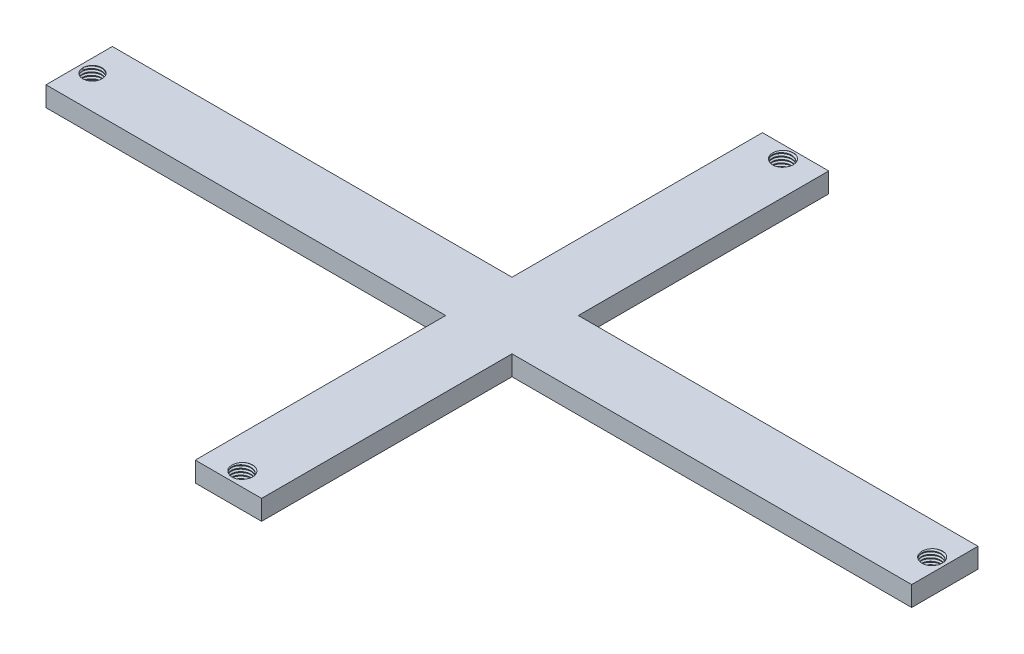
from build123d import *

# Parameters (mm, degrees)
SKETCH1_W                  = 130.5
SKETCH1_H                  = 10
SKETCH1_W_2                = 10
SKETCH1_H_2                = 85.5
BOSS_EXTRUDE1_DEPTH        = 3
M2_5_CLEARANCE_HOLE1_D     = 2.9
M2_5_CLEARANCE_HOLE1_DEPTH = 3
M2_5_CLEARANCE_HOLE1_TIP   = 0.871247898
M2_5_CLEARANCE_HOLE2_D     = 2.9
M2_5_CLEARANCE_HOLE2_DEPTH = 3
M2_5_CLEARANCE_HOLE2_TIP   = 0.871247898
M2_5_CLEARANCE_HOLE3_D     = 2.9
M2_5_CLEARANCE_HOLE3_DEPTH = 3
M2_5_CLEARANCE_HOLE3_TIP   = 0.871247898
M2_5_CLEARANCE_HOLE4_D     = 2.9
M2_5_CLEARANCE_HOLE4_DEPTH = 3
M2_5_CLEARANCE_HOLE4_TIP   = 0.871247898
THREAD4_PITCH              = 0.45
THREAD5_PITCH              = 0.45
THREAD6_PITCH              = 0.45
THREAD7_PITCH              = 0.45


with BuildPart() as part:
    # Sketch1 → Boss-Extrude1 (new body)
    with BuildSketch(Plane(origin=(0, 0, 0), x_dir=(1, 0, 0), z_dir=(0, 1, 0))):
        with Locations((40.207417437, 2.647058824)):
            Rectangle(SKETCH1_W, SKETCH1_H)
        with Locations((40.207417437, 2.647058824)):
            Rectangle(SKETCH1_W_2, SKETCH1_H_2)
    extrude(amount=BOSS_EXTRUDE1_DEPTH)

    # M2.5 Clearance Hole1
    with Locations(Plane(origin=(0, 3, 0), x_dir=(1, 0, 0), z_dir=(0, 1, 0))):
        with Locations((-23.042582563, 2.647058824)):
            Hole(M2_5_CLEARANCE_HOLE1_D / 2, depth=M2_5_CLEARANCE_HOLE1_DEPTH)
            with Locations((0, 0, -(M2_5_CLEARANCE_HOLE1_DEPTH + M2_5_CLEARANCE_HOLE1_TIP / 2))):  # 118° drill point
                Cone(0, M2_5_CLEARANCE_HOLE1_D / 2, M2_5_CLEARANCE_HOLE1_TIP, mode=Mode.SUBTRACT)

    # M2.5 Clearance Hole2
    with Locations(Plane(origin=(0, 3, 0), x_dir=(1, 0, 0), z_dir=(0, 1, 0))):
        with Locations((40.207417437, 43.397058824)):
            Hole(M2_5_CLEARANCE_HOLE2_D / 2, depth=M2_5_CLEARANCE_HOLE2_DEPTH)
            with Locations((0, 0, -(M2_5_CLEARANCE_HOLE2_DEPTH + M2_5_CLEARANCE_HOLE2_TIP / 2))):  # 118° drill point
                Cone(0, M2_5_CLEARANCE_HOLE2_D / 2, M2_5_CLEARANCE_HOLE2_TIP, mode=Mode.SUBTRACT)

    # M2.5 Clearance Hole3
    with Locations(Plane(origin=(0, 3, 0), x_dir=(1, 0, 0), z_dir=(0, 1, 0))):
        with Locations((103.457417437, 2.647058824)):
            Hole(M2_5_CLEARANCE_HOLE3_D / 2, depth=M2_5_CLEARANCE_HOLE3_DEPTH)
            with Locations((0, 0, -(M2_5_CLEARANCE_HOLE3_DEPTH + M2_5_CLEARANCE_HOLE3_TIP / 2))):  # 118° drill point
                Cone(0, M2_5_CLEARANCE_HOLE3_D / 2, M2_5_CLEARANCE_HOLE3_TIP, mode=Mode.SUBTRACT)

    # M2.5 Clearance Hole4
    with Locations(Plane(origin=(0, 3, 0), x_dir=(1, 0, 0), z_dir=(0, 1, 0))):
        with Locations((40.207417437, -38.102941176)):
            Hole(M2_5_CLEARANCE_HOLE4_D / 2, depth=M2_5_CLEARANCE_HOLE4_DEPTH)
            with Locations((0, 0, -(M2_5_CLEARANCE_HOLE4_DEPTH + M2_5_CLEARANCE_HOLE4_TIP / 2))):  # 118° drill point
                Cone(0, M2_5_CLEARANCE_HOLE4_D / 2, M2_5_CLEARANCE_HOLE4_TIP, mode=Mode.SUBTRACT)

    # Thread4: the profile of Thread Profile4 profile screwed along a right-hand helix of 7.649606 turns, 6 arcs to a turn; built about Z, then put on its axis
    thread4_z = Axis((0, 0, 0), (0, 0, 1))
    thread4_corners = [(1.4497, 0, -0.000173205), (1.693569644, 0, 0.140624999), (1.693569644, 0, 0.196874999), (1.4497, 0, 0.337673204)]
    with BuildLine(mode=Mode.PRIVATE) as thread4_profile:
        Line(thread4_corners[0], thread4_corners[1])
        Line(thread4_corners[1], thread4_corners[2])
        Line(thread4_corners[2], thread4_corners[3])
        Line(thread4_corners[3], thread4_corners[0])
    thread4_cap = Face(thread4_profile.wire())
    thread4_turn_angles = [0, 30, 60, 90, 120, 150, 180, 210, 240, 270, 300, 330, 360]
    thread4_turn_weights = [1, 0.8660254037844387, 1, 0.8660254037844387, 1, 0.8660254037844387, 1, 0.8660254037844387, 1, 0.8660254037844387, 1, 0.8660254037844387, 1]
    thread4_turn_rails = [Edge.make_bspline([Vector(p[0], p[1], 0).rotate(thread4_z, thread4_turn_angles[k]) / thread4_turn_weights[k] + Vector(0, 0, p[2] + THREAD4_PITCH * thread4_turn_angles[k] / 360) for k in range(13)], [0, 0, 0, 1, 1, 2, 2, 3, 3, 4, 4, 5, 5, 6, 6, 6], 2, thread4_turn_weights) for p in thread4_corners]
    thread4_turn_sides = [Face.make_surface_from_curves(thread4_turn_rails[p[0]], thread4_turn_rails[p[1]]) for p in [(0, 1), (1, 2), (2, 3), (3, 0)]]
    thread4_last_angles = [2520, 2550, 2580, 2610, 2640, 2670, 2700, 2726.929133858, 2753.858267717]
    thread4_last_weights = [1, 0.8660254037844387, 1, 0.8660254037844387, 1, 0.8660254037844387, 1, 0.8915673595333442, 1]
    thread4_last_rails = [Edge.make_bspline([Vector(p[0], p[1], 0).rotate(thread4_z, thread4_last_angles[k]) / thread4_last_weights[k] + Vector(0, 0, p[2] + THREAD4_PITCH * thread4_last_angles[k] / 360) for k in range(9)], [0, 0, 0, 1, 1, 2, 2, 3, 3, 4, 4, 4], 2, thread4_last_weights) for p in thread4_corners]
    thread4_last_sides = [Face.make_surface_from_curves(thread4_last_rails[p[0]], thread4_last_rails[p[1]]) for p in [(0, 1), (1, 2), (2, 3), (3, 0)]]
    thread4 = Plane(origin=(-23.042582563, 3, -2.647058824), x_dir=(-1, 0, 0), z_dir=(0, -1, 0)) * Solid(Shell([*[p.moved(Location((0, 0, THREAD4_PITCH * i))) for i in range(7) for p in thread4_turn_sides], *thread4_last_sides, thread4_cap, thread4_cap.rotate(thread4_z, 2753.858267717).moved(Location((0, 0, THREAD4_PITCH * 2753.858267717 / 360)))]))
    add(thread4, mode=Mode.SUBTRACT)

    # Thread5: the profile of Thread Profile5 profile screwed along a right-hand helix of 7.649606 turns, 6 arcs to a turn; built about Z, then put on its axis
    thread5_z = Axis((0, 0, 0), (0, 0, 1))
    thread5_corners = [(1.4497, 0, -0.000173205), (1.693569643, 0, 0.140624999), (1.693569643, 0, 0.196874999), (1.4497, 0, 0.337673204)]
    with BuildLine(mode=Mode.PRIVATE) as thread5_profile:
        Line(thread5_corners[0], thread5_corners[1])
        Line(thread5_corners[1], thread5_corners[2])
        Line(thread5_corners[2], thread5_corners[3])
        Line(thread5_corners[3], thread5_corners[0])
    thread5_cap = Face(thread5_profile.wire())
    thread5_turn_angles = [0, 30, 60, 90, 120, 150, 180, 210, 240, 270, 300, 330, 360]
    thread5_turn_weights = [1, 0.8660254037844387, 1, 0.8660254037844387, 1, 0.8660254037844387, 1, 0.8660254037844387, 1, 0.8660254037844387, 1, 0.8660254037844387, 1]
    thread5_turn_rails = [Edge.make_bspline([Vector(p[0], p[1], 0).rotate(thread5_z, thread5_turn_angles[k]) / thread5_turn_weights[k] + Vector(0, 0, p[2] + THREAD5_PITCH * thread5_turn_angles[k] / 360) for k in range(13)], [0, 0, 0, 1, 1, 2, 2, 3, 3, 4, 4, 5, 5, 6, 6, 6], 2, thread5_turn_weights) for p in thread5_corners]
    thread5_turn_sides = [Face.make_surface_from_curves(thread5_turn_rails[p[0]], thread5_turn_rails[p[1]]) for p in [(0, 1), (1, 2), (2, 3), (3, 0)]]
    thread5_last_angles = [2520, 2550, 2580, 2610, 2640, 2670, 2700, 2726.929133858, 2753.858267717]
    thread5_last_weights = [1, 0.8660254037844387, 1, 0.8660254037844387, 1, 0.8660254037844387, 1, 0.8915673595333442, 1]
    thread5_last_rails = [Edge.make_bspline([Vector(p[0], p[1], 0).rotate(thread5_z, thread5_last_angles[k]) / thread5_last_weights[k] + Vector(0, 0, p[2] + THREAD5_PITCH * thread5_last_angles[k] / 360) for k in range(9)], [0, 0, 0, 1, 1, 2, 2, 3, 3, 4, 4, 4], 2, thread5_last_weights) for p in thread5_corners]
    thread5_last_sides = [Face.make_surface_from_curves(thread5_last_rails[p[0]], thread5_last_rails[p[1]]) for p in [(0, 1), (1, 2), (2, 3), (3, 0)]]
    thread5 = Plane(origin=(40.207417437, 0, -43.397058824), x_dir=(1, 0, 0), z_dir=(0, 1, 0)) * Solid(Shell([*[p.moved(Location((0, 0, THREAD5_PITCH * i))) for i in range(7) for p in thread5_turn_sides], *thread5_last_sides, thread5_cap, thread5_cap.rotate(thread5_z, 2753.858267717).moved(Location((0, 0, THREAD5_PITCH * 2753.858267717 / 360)))]))
    add(thread5, mode=Mode.SUBTRACT)

    # Thread6: the profile of Thread Profile6 profile screwed along a right-hand helix of 7.649606 turns, 6 arcs to a turn; built about Z, then put on its axis
    thread6_z = Axis((0, 0, 0), (0, 0, 1))
    thread6_corners = [(1.4497, 0, -0.000173205), (1.693569643, 0, 0.140624999), (1.693569643, 0, 0.196874999), (1.4497, 0, 0.337673204)]
    with BuildLine(mode=Mode.PRIVATE) as thread6_profile:
        Line(thread6_corners[0], thread6_corners[1])
        Line(thread6_corners[1], thread6_corners[2])
        Line(thread6_corners[2], thread6_corners[3])
        Line(thread6_corners[3], thread6_corners[0])
    thread6_cap = Face(thread6_profile.wire())
    thread6_turn_angles = [0, 30, 60, 90, 120, 150, 180, 210, 240, 270, 300, 330, 360]
    thread6_turn_weights = [1, 0.8660254037844387, 1, 0.8660254037844387, 1, 0.8660254037844387, 1, 0.8660254037844387, 1, 0.8660254037844387, 1, 0.8660254037844387, 1]
    thread6_turn_rails = [Edge.make_bspline([Vector(p[0], p[1], 0).rotate(thread6_z, thread6_turn_angles[k]) / thread6_turn_weights[k] + Vector(0, 0, p[2] + THREAD6_PITCH * thread6_turn_angles[k] / 360) for k in range(13)], [0, 0, 0, 1, 1, 2, 2, 3, 3, 4, 4, 5, 5, 6, 6, 6], 2, thread6_turn_weights) for p in thread6_corners]
    thread6_turn_sides = [Face.make_surface_from_curves(thread6_turn_rails[p[0]], thread6_turn_rails[p[1]]) for p in [(0, 1), (1, 2), (2, 3), (3, 0)]]
    thread6_last_angles = [2520, 2550, 2580, 2610, 2640, 2670, 2700, 2726.929133858, 2753.858267717]
    thread6_last_weights = [1, 0.8660254037844387, 1, 0.8660254037844387, 1, 0.8660254037844387, 1, 0.8915673595333442, 1]
    thread6_last_rails = [Edge.make_bspline([Vector(p[0], p[1], 0).rotate(thread6_z, thread6_last_angles[k]) / thread6_last_weights[k] + Vector(0, 0, p[2] + THREAD6_PITCH * thread6_last_angles[k] / 360) for k in range(9)], [0, 0, 0, 1, 1, 2, 2, 3, 3, 4, 4, 4], 2, thread6_last_weights) for p in thread6_corners]
    thread6_last_sides = [Face.make_surface_from_curves(thread6_last_rails[p[0]], thread6_last_rails[p[1]]) for p in [(0, 1), (1, 2), (2, 3), (3, 0)]]
    thread6 = Plane(origin=(103.457417437, 0, -2.647058824), x_dir=(1, 0, 0), z_dir=(0, 1, 0)) * Solid(Shell([*[p.moved(Location((0, 0, THREAD6_PITCH * i))) for i in range(7) for p in thread6_turn_sides], *thread6_last_sides, thread6_cap, thread6_cap.rotate(thread6_z, 2753.858267717).moved(Location((0, 0, THREAD6_PITCH * 2753.858267717 / 360)))]))
    add(thread6, mode=Mode.SUBTRACT)

    # Thread7: the profile of Thread Profile7 profile screwed along a right-hand helix of 7.649606 turns, 6 arcs to a turn; built about Z, then put on its axis
    thread7_z = Axis((0, 0, 0), (0, 0, 1))
    thread7_corners = [(1.4497, 0, -0.000173205), (1.693569643, 0, 0.140624999), (1.693569643, 0, 0.196874999), (1.4497, 0, 0.337673204)]
    with BuildLine(mode=Mode.PRIVATE) as thread7_profile:
        Line(thread7_corners[0], thread7_corners[1])
        Line(thread7_corners[1], thread7_corners[2])
        Line(thread7_corners[2], thread7_corners[3])
        Line(thread7_corners[3], thread7_corners[0])
    thread7_cap = Face(thread7_profile.wire())
    thread7_turn_angles = [0, 30, 60, 90, 120, 150, 180, 210, 240, 270, 300, 330, 360]
    thread7_turn_weights = [1, 0.8660254037844387, 1, 0.8660254037844387, 1, 0.8660254037844387, 1, 0.8660254037844387, 1, 0.8660254037844387, 1, 0.8660254037844387, 1]
    thread7_turn_rails = [Edge.make_bspline([Vector(p[0], p[1], 0).rotate(thread7_z, thread7_turn_angles[k]) / thread7_turn_weights[k] + Vector(0, 0, p[2] + THREAD7_PITCH * thread7_turn_angles[k] / 360) for k in range(13)], [0, 0, 0, 1, 1, 2, 2, 3, 3, 4, 4, 5, 5, 6, 6, 6], 2, thread7_turn_weights) for p in thread7_corners]
    thread7_turn_sides = [Face.make_surface_from_curves(thread7_turn_rails[p[0]], thread7_turn_rails[p[1]]) for p in [(0, 1), (1, 2), (2, 3), (3, 0)]]
    thread7_last_angles = [2520, 2550, 2580, 2610, 2640, 2670, 2700, 2726.929133858, 2753.858267717]
    thread7_last_weights = [1, 0.8660254037844387, 1, 0.8660254037844387, 1, 0.8660254037844387, 1, 0.8915673595333442, 1]
    thread7_last_rails = [Edge.make_bspline([Vector(p[0], p[1], 0).rotate(thread7_z, thread7_last_angles[k]) / thread7_last_weights[k] + Vector(0, 0, p[2] + THREAD7_PITCH * thread7_last_angles[k] / 360) for k in range(9)], [0, 0, 0, 1, 1, 2, 2, 3, 3, 4, 4, 4], 2, thread7_last_weights) for p in thread7_corners]
    thread7_last_sides = [Face.make_surface_from_curves(thread7_last_rails[p[0]], thread7_last_rails[p[1]]) for p in [(0, 1), (1, 2), (2, 3), (3, 0)]]
    thread7 = Plane(origin=(40.207417437, 0, 38.102941176), x_dir=(1, 0, 0), z_dir=(0, 1, 0)) * Solid(Shell([*[p.moved(Location((0, 0, THREAD7_PITCH * i))) for i in range(7) for p in thread7_turn_sides], *thread7_last_sides, thread7_cap, thread7_cap.rotate(thread7_z, 2753.858267717).moved(Location((0, 0, THREAD7_PITCH * 2753.858267717 / 360)))]))
    add(thread7, mode=Mode.SUBTRACT)


solid = part.part
